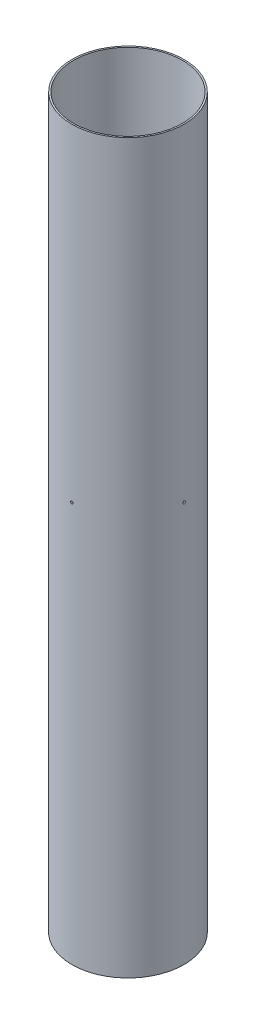
from build123d import *

# Parameters (mm, degrees)
SKETCH1_R           = 78.359
SKETCH1_R_2         = 76.1746
BOSS_EXTRUDE1_DEPTH = 1016
SKETCH3_R           = 1.750000056
CUT_EXTRUDE1_DEPTH  = 1023.025570014
CIRPATTERN1_COUNT   = 4


with BuildPart() as part:
    # Sketch1 → Boss-Extrude1 (new body)
    with BuildSketch(Plane(origin=(0, 0, 0), x_dir=(1, 0, 0), z_dir=(0, 1, 0))):
        Circle(SKETCH1_R)
        Circle(SKETCH1_R_2, mode=Mode.SUBTRACT)
    extrude(amount=BOSS_EXTRUDE1_DEPTH)

    # Sketch3 → Cut-Extrude1 (cut, through all)
    with BuildSketch(Plane.XY):
        with Locations((0, 558.8)):
            Circle(SKETCH3_R)
    cut_extrude1 = extrude(amount=-CUT_EXTRUDE1_DEPTH, mode=Mode.SUBTRACT)

    # CirPattern1: Cut-Extrude1 ×4 about axis
    cirpattern1_axis = Axis((0, 1016, 0), (0, -1, 0))
    for i in range(1, CIRPATTERN1_COUNT):
        add(cut_extrude1.rotate(cirpattern1_axis, i * 360 / CIRPATTERN1_COUNT), mode=Mode.SUBTRACT)


solid = part.part
